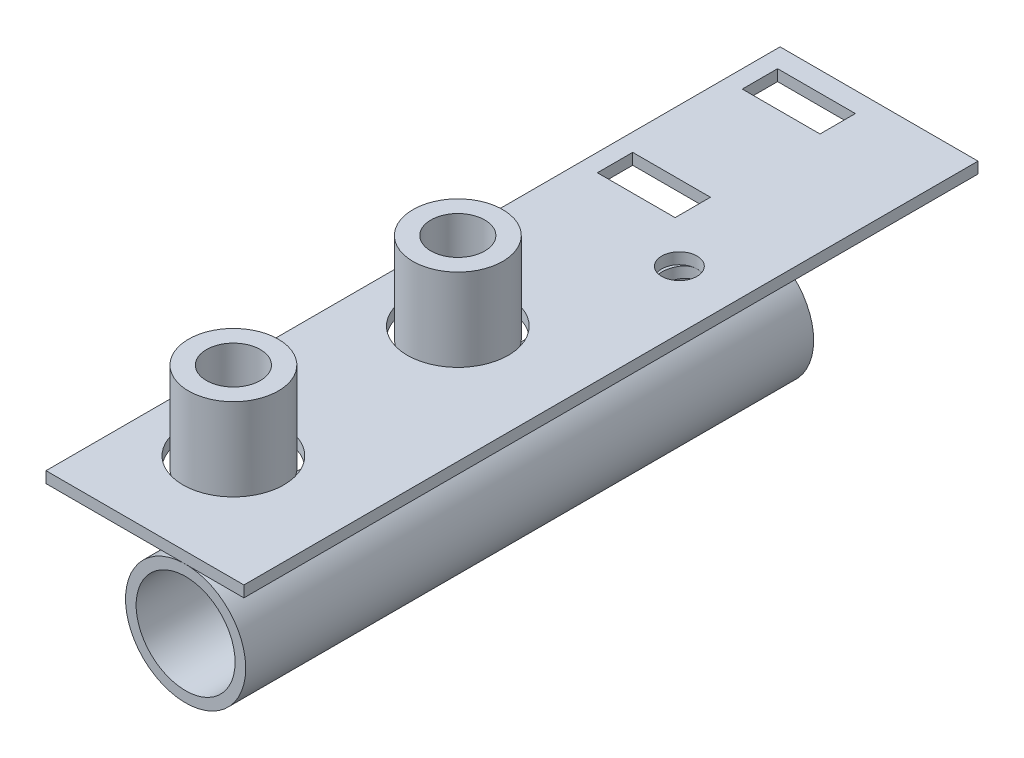
from build123d import *

# Parameters (mm, degrees)
SKETCH1_W                  = 56
SKETCH1_H                  = 207.7
SKETCH1_R                  = 5
SKETCH1_W_2                = 22
SKETCH1_H_2                = 10
BASE_FLANGE1_DEPTH         = 3.175
BOSS_EXTRUDE2_DEPTH        = 139.7
BOSS_EXTRUDE2_DEPTH_BACK   = 21
SKETCH7_R                  = 17
SKETCH7_R_2                = 14
SKETCH8_R                  = 5
CUT_EXTRUDE1_DEPTH         = 150.861004351
SKETCH6_R                  = 14.2875
CUT_EXTRUDE2_DEPTH         = 3.175
BOSS_EXTRUDE3_DEPTH        = 22.225
BOSS_EXTRUDE3_DEPTH_BACK   = 3.175
SKETCH6_4_R                = 12.7
SKETCH6_4_R_2              = 7.62
BOSS_EXTRUDE3_2_DEPTH      = 22.225
BOSS_EXTRUDE3_2_DEPTH_BACK = 3.175


# Sheet-metal steps are written as plain solids
with BuildPart() as part:
    # Sketch1 → Base-Flange1 (new body)
    with BuildSketch(Plane(origin=(0, 0, 0), x_dir=(1, 0, 0), z_dir=(0, 1, 0))):
        with Locations((-11.5, -35.85)):
            Rectangle(SKETCH1_W, SKETCH1_H)
        with Locations(Location((0, 0, 0), (0, 0, 270))):
            Circle(SKETCH1_R, mode=Mode.SUBTRACT)
        with Locations((-23.5, 57.3)):
            Rectangle(SKETCH1_W_2, SKETCH1_H_2, mode=Mode.SUBTRACT)
        with Locations((-23.5, 16.3)):
            Rectangle(SKETCH1_W_2, SKETCH1_H_2, mode=Mode.SUBTRACT)
    extrude(amount=-BASE_FLANGE1_DEPTH)

    # Sketch6 → Cut-Extrude2 (cut)
    with BuildSketch(Plane(origin=(0, 0, 0), x_dir=(1, 0, 0), z_dir=(0, 1, 0))):
        with Locations(Location((-16.64, -46.0375, 0), (0, 0, 270))):
            Circle(SKETCH6_R)
        with Locations(Location((-16.64, -109.5375, 0), (0, 0, 270))):
            Circle(SKETCH6_R)
    extrude(amount=-CUT_EXTRUDE2_DEPTH, mode=Mode.SUBTRACT)


with BuildPart() as body_2:
    # Sketch7 → Boss-Extrude2 (new, two sides: drawn at the far end of the back side and taken through both)
    with BuildSketch(Plane.XY.offset(-BOSS_EXTRUDE2_DEPTH_BACK)):
        with Locations((0, -20.175)):
            Circle(SKETCH7_R)
        with Locations((0, -20.175)):
            Circle(SKETCH7_R_2, mode=Mode.SUBTRACT)
    extrude(amount=BOSS_EXTRUDE2_DEPTH + BOSS_EXTRUDE2_DEPTH_BACK)

    # Sketch8 → Cut-Extrude1 (cut, through all)
    with BuildSketch(Plane(origin=(0, 0, 0), x_dir=(1, 0, 0), z_dir=(0, 1, 0))):
        with Locations(Location((0, 0, 0), (0, 0, 270))):
            Circle(SKETCH8_R)
    extrude(amount=-CUT_EXTRUDE1_DEPTH, mode=Mode.SUBTRACT)


with BuildPart() as body_3:
    # Sketch6<4> → Boss-Extrude3 (new, two sides: drawn at the far end of the back side and taken through both)
    with BuildSketch(Plane(origin=(0, 0, 0), x_dir=(1, 0, 0), z_dir=(0, 1, 0)).offset(-BOSS_EXTRUDE3_DEPTH_BACK)):
        with Locations(Location((-16.64, -46.0375, 0), (0, 0, 270))):
            Circle(SKETCH6_4_R)
        with Locations(Location((-16.64, -46.0375, 0), (0, 0, 270))):
            Circle(SKETCH6_4_R_2, mode=Mode.SUBTRACT)
    extrude(amount=BOSS_EXTRUDE3_DEPTH + BOSS_EXTRUDE3_DEPTH_BACK)


with BuildPart() as body_4:
    # Sketch6<4> → Boss-Extrude3 2 (new, two sides: drawn at the far end of the back side and taken through both)
    with BuildSketch(Plane(origin=(0, 0, 0), x_dir=(1, 0, 0), z_dir=(0, 1, 0)).offset(-BOSS_EXTRUDE3_2_DEPTH_BACK)):
        with Locations(Location((-16.64, -109.5375, 0), (0, 0, 90))):
            Circle(SKETCH6_4_R)
        with Locations(Location((-16.64, -109.5375, 0), (0, 0, 90))):
            Circle(SKETCH6_4_R_2, mode=Mode.SUBTRACT)
    extrude(amount=BOSS_EXTRUDE3_2_DEPTH + BOSS_EXTRUDE3_2_DEPTH_BACK)


solid = Compound([part.part, body_2.part, body_3.part, body_4.part])
